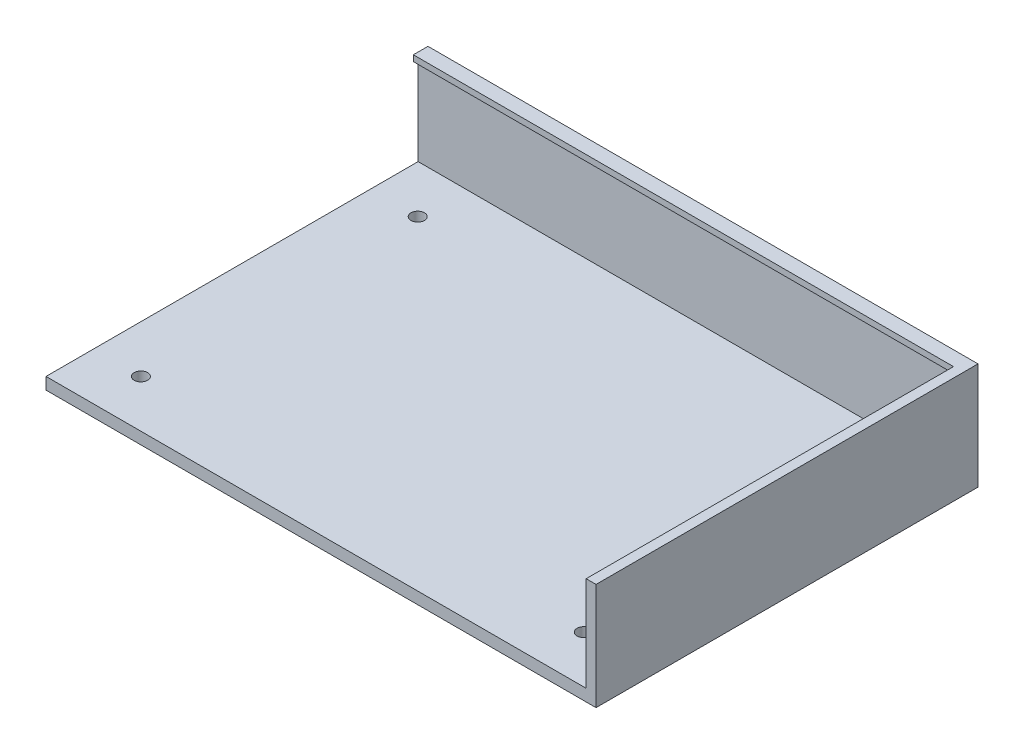
from build123d import *

# Parameters (mm, degrees)
SKETCH1_W                     = 278.2
SKETCH1_H                     = 193.2
SHELL_BLOCK_DEPTH             = 27
SKETCH2_W                     = 273.2
SKETCH2_H                     = 185.8
FRONT_OPENING_DEPTH           = 1.5
SKETCH3_W                     = 273.2
SKETCH3_H                     = 188.2
DISPLAY_POCKET_DEPTH          = 22.5
SKETCH4_W                     = 3
SKETCH4_H                     = 56
VENT_SLOTS_DEPTH              = 4
SKETCH5_W                     = 58
SKETCH5_H                     = 23
CABLE_EXIT_X_SHORT_SIDE_DEPTH = 140.1
SKETCH6_R                     = 1.7
BOLT_HOLES_DEPTH              = 4
KEEP_ONE_HALF_X_DEPTH         = 172.491603293
KEEP_ONE_HALF_X_DEPTH_BACK    = 172.491603293
SKETCH7_W                     = 200
SKETCH7_H                     = 400
KEEP_ONE_QUARTER_Z_DEPTH      = 172.491603293
KEEP_ONE_QUARTER_Z_DEPTH_BACK = 172.491603293
SKETCH8_W                     = 400
SKETCH8_H                     = 200


with BuildPart() as part:
    # Sketch1 → Shell Block (new body)
    with BuildSketch(Plane(origin=(0, 0, 0), x_dir=(1, 0, 0), z_dir=(0, 1, 0))):
        Rectangle(SKETCH1_W, SKETCH1_H)
    extrude(amount=SHELL_BLOCK_DEPTH)

    # Sketch2 → Front Opening (cut)
    with BuildSketch(Plane(origin=(0, 27, 0), x_dir=(1, 0, 0), z_dir=(0, 1, 0))):
        Rectangle(SKETCH2_W, SKETCH2_H)
    extrude(amount=-FRONT_OPENING_DEPTH, mode=Mode.SUBTRACT)

    # Sketch3 → Display Pocket (cut)
    with BuildSketch(Plane(origin=(0, 25.5, 0), x_dir=(1, 0, 0), z_dir=(0, 1, 0))):
        Rectangle(SKETCH3_W, SKETCH3_H)
    extrude(amount=-DISPLAY_POCKET_DEPTH, mode=Mode.SUBTRACT)

    # Sketch4 → Vent Slots (cut)
    with BuildSketch(Plane(origin=(0, 3, 0), x_dir=(1, 0, 0), z_dir=(0, 1, 0))):
        with Locations((-67.5, 56)):
            Rectangle(SKETCH4_W, SKETCH4_H)
        with Locations((-67.5, -56)):
            Rectangle(SKETCH4_W, SKETCH4_H)
        with Locations((-75.5, 56)):
            Rectangle(SKETCH4_W, SKETCH4_H)
        with Locations((-75.5, -56)):
            Rectangle(SKETCH4_W, SKETCH4_H)
        with Locations((-83.5, 56)):
            Rectangle(SKETCH4_W, SKETCH4_H)
        with Locations((-83.5, -56)):
            Rectangle(SKETCH4_W, SKETCH4_H)
        with Locations((-91.5, 56)):
            Rectangle(SKETCH4_W, SKETCH4_H)
        with Locations((-91.5, -56)):
            Rectangle(SKETCH4_W, SKETCH4_H)
        with Locations((-99.5, 56)):
            Rectangle(SKETCH4_W, SKETCH4_H)
        with Locations((-99.5, -56)):
            Rectangle(SKETCH4_W, SKETCH4_H)
        with Locations((-107.5, 56)):
            Rectangle(SKETCH4_W, SKETCH4_H)
        with Locations((-107.5, -56)):
            Rectangle(SKETCH4_W, SKETCH4_H)
        with Locations((-115.5, 56)):
            Rectangle(SKETCH4_W, SKETCH4_H)
        with Locations((-115.5, -56)):
            Rectangle(SKETCH4_W, SKETCH4_H)
        with Locations((-123.5, 56)):
            Rectangle(SKETCH4_W, SKETCH4_H)
        with Locations((-123.5, -56)):
            Rectangle(SKETCH4_W, SKETCH4_H)
    extrude(amount=-VENT_SLOTS_DEPTH, mode=Mode.SUBTRACT)

    # Sketch5 → Cable Exit (-X short side) (cut)
    with BuildSketch(Plane(origin=(0, 0, 0), x_dir=(0, 0, -1), z_dir=(1, 0, 0))):
        with Locations((0, 16.5)):
            Rectangle(SKETCH5_W, SKETCH5_H)
    extrude(amount=-CABLE_EXIT_X_SHORT_SIDE_DEPTH, mode=Mode.SUBTRACT)

    # Sketch6 → Bolt Holes (cut)
    with BuildSketch(Plane(origin=(0, 3, 0), x_dir=(1, 0, 0), z_dir=(0, 1, 0))):
        with Locations((-40, -29)):
            Circle(SKETCH6_R)
        with Locations((-40, -89)):
            Circle(SKETCH6_R)
        with Locations((40, -29)):
            Circle(SKETCH6_R)
        with Locations((40, -89)):
            Circle(SKETCH6_R)
        with Locations((-52, -47)):
            Circle(SKETCH6_R)
        with Locations((-52, -71)):
            Circle(SKETCH6_R)
        with Locations((52, -47)):
            Circle(SKETCH6_R)
        with Locations((52, -71)):
            Circle(SKETCH6_R)
        with Locations((-12, 82)):
            Circle(SKETCH6_R)
        with Locations((12, 82)):
            Circle(SKETCH6_R)
        with Locations((124, 12)):
            Circle(SKETCH6_R)
        with Locations((124, -12)):
            Circle(SKETCH6_R)
        with Locations((-12, 12)):
            Circle(SKETCH6_R)
        with Locations((-12, -12)):
            Circle(SKETCH6_R)
        with Locations((12, 12)):
            Circle(SKETCH6_R)
        with Locations((12, -12)):
            Circle(SKETCH6_R)
        with Locations((-110, -12)):
            Circle(SKETCH6_R)
        with Locations((-110, 12)):
            Circle(SKETCH6_R)
        with Locations((-86, -12)):
            Circle(SKETCH6_R)
        with Locations((-86, 12)):
            Circle(SKETCH6_R)
    extrude(amount=-BOLT_HOLES_DEPTH, mode=Mode.SUBTRACT)

    # Sketch7 → Keep one half (X) (cut, two sides: drawn at the far end of the back side and taken through both)
    with BuildSketch(Plane(origin=(0, 0, 0), x_dir=(1, 0, 0), z_dir=(0, 1, 0)).offset(-KEEP_ONE_HALF_X_DEPTH_BACK)):
        with Locations((-100, 0)):
            Rectangle(SKETCH7_W, SKETCH7_H)
    extrude(amount=KEEP_ONE_HALF_X_DEPTH + KEEP_ONE_HALF_X_DEPTH_BACK, mode=Mode.SUBTRACT)

    # Sketch8 → Keep one quarter (Z) (cut, two sides: drawn at the far end of the back side and taken through both)
    with BuildSketch(Plane(origin=(0, 0, 0), x_dir=(1, 0, 0), z_dir=(0, 1, 0)).offset(-KEEP_ONE_QUARTER_Z_DEPTH_BACK)):
        with Locations((0, -100)):
            Rectangle(SKETCH8_W, SKETCH8_H)
    extrude(amount=KEEP_ONE_QUARTER_Z_DEPTH + KEEP_ONE_QUARTER_Z_DEPTH_BACK, mode=Mode.SUBTRACT)


solid = part.part
